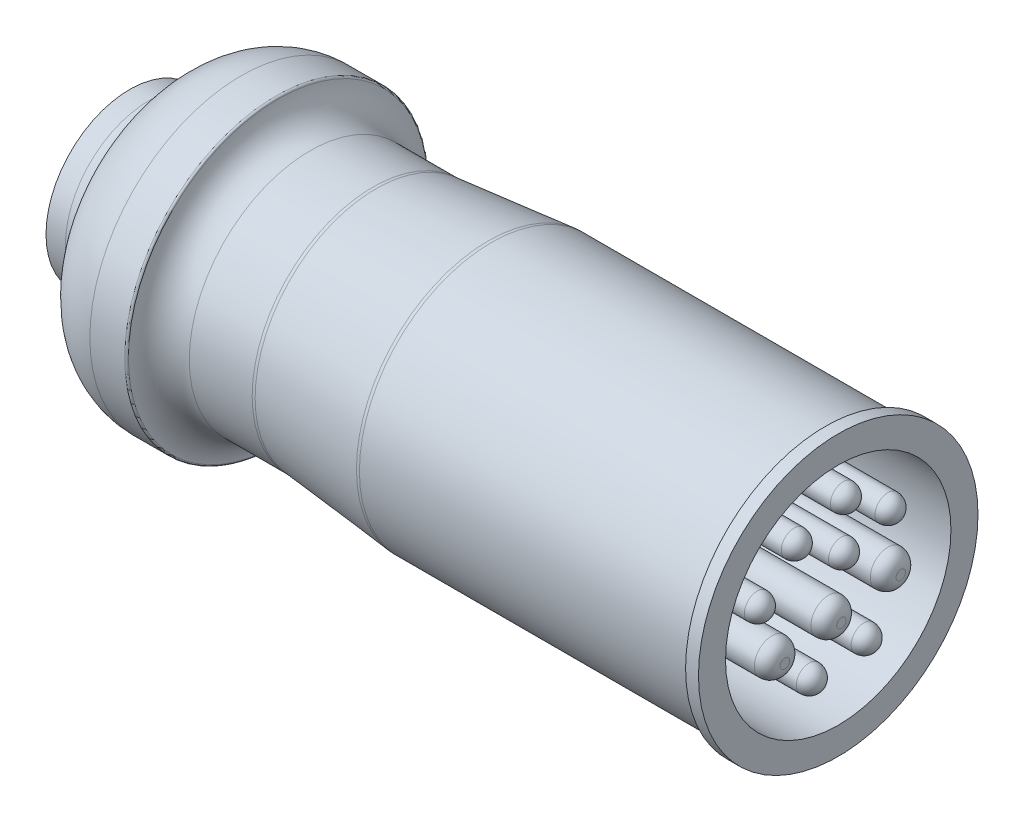
from build123d import *

# Parameters (mm, degrees)
FILLET1_R           = 5
FILLET2_R           = 0.3
FILLET3_R           = 5
SKETCH4_R           = 17.500000000000004
CUT_EXTRUDE1_DEPTH  = 35
SKETCH5_R           = 2.0006066698857174
SKETCH5_R_2         = 2.0006066698857157
SKETCH5_R_3         = 2.000606669885716
SKETCH5_R_4         = 2.733173099565215
BOSS_EXTRUDE1_DEPTH = 35
FILLET4_R           = 2
BOSS_EXTRUDE2_START = -2
SKETCH6_R           = 21.7
SKETCH6_R_2         = 20.5
BOSS_EXTRUDE2_DEPTH = 2


with BuildPart() as part:
    # Sketch3 → Revolve1 (revolve)
    with BuildSketch(Plane.XY, mode=Mode.PRIVATE) as revolve1_sk:
        with BuildLine():
            Line((65, 0), (65, 20.5))
            Line((65, 20.5), (10.914728577346645, 20.499999999999993))
            Line((10.914728577346645, 20.499999999999993), (-6.999999999999965, 18.75))
            Line((-6.999999999999965, 18.75), (-21.999999999999996, 18.749999999999993))
            Line((-21.999999999999996, 18.749999999999993), (-21.999999999999996, 23.5))
            Line((-21.999999999999996, 23.5), (-27.690911978745813, 23.5))
            ThreePointArc((-27.690911978745813, 23.5), (-34.19859974015539, 21.368483523128404), (-38.18424319433221, 15.800000000000004))
            ThreePointArc((-38.18424319433221, 15.800000000000004), (-39.63356808676015, 13.775096900680587), (-41.99999999999999, 13.000000000000009))
            Line((-41.99999999999999, 13.000000000000009), (-45, 13.000000000000004))
            Line((-45, 13.000000000000004), (-45, 0))
            Line((-45, 0), (-41.99999999999999, 0))
            Line((-41.99999999999999, 0), (65, 0))
        make_face()
    revolve(revolve1_sk.sketch.rotate(Axis((0, 0, 0), (1, 0, 0)), 90), axis=Axis((0, 0, 0), (1, 0, 0)))

    # Fillet1
    # the kernel refuses this fillet: 5 mm, written as the material it adds along each edge
    with BuildSketch(Plane(origin=(-21.999999999999996, 0, 0), x_dir=(0, 1.1e-16, 1), z_dir=(0, 1, -1.1e-16))) as fillet1_piece_1:
        with BuildLine():
            CenterArc((23.75, 4.993746088859545), FILLET1_R, 180, 87.13401601740111)
            Line((23.5, 0), (23.495, -0.09987492177718948))
            ThreePointArc((23.495, -0.09987492177718948), (21.124999999999996, -0.10000000000000142), (18.749999999999993, -0.10000000000000142))
            Line((18.749999999999993, -0.10000000000000142), (18.64999999999999, 0))
            Line((18.64999999999999, 0), (18.65, 4.993746088859545))
            Line((18.65, 4.993746088859545), (18.75, 4.993746088859545))
        make_face()
    revolve(axis=Axis((-21.999999999999996, 0, 0), (1, 0, 0)))

    # Fillet2
    fillet2_edges = [part.edges().sort_by_distance(p)[0] for p in [
        (-21.999999999999996, 4.95e-15, -23.5),
    ]]
    fillet(fillet2_edges, radius=FILLET2_R)

    # Fillet3
    # the kernel refuses this fillet: 5 mm, written as the material it adds along each edge
    with BuildSketch(Plane(origin=(-6.999999999999965, 0, 0), x_dir=(0, 1.1e-16, 1), z_dir=(0, 1, -1.1e-16))) as fillet3_piece_1:
        with BuildLine():
            CenterArc((18.75 + FILLET3_R, -FILLET3_R * 0.0487265272305), FILLET3_R, 174.42076403235384, 5.579235967646127)
            Line((18.75 + FILLET3_R * 0.00473730125852, FILLET3_R * 0.0484956949917), (18.75, 0))
            Line((18.75, 0), (18.75, -FILLET3_R * 0.0487265272305))
        make_face()
    revolve(axis=Axis((-6.999999999999965, 0, 0), (1, 0, 0)))
    # the kernel refuses this fillet: 5 mm, written as the material it takes off along each edge
    with BuildSketch(Plane(origin=(10.914728577346645, 0, 0), x_dir=(0, 1.1e-16, 1), z_dir=(0, 1, -1.1e-16))) as fillet3_2_piece_1:
        with BuildLine():
            CenterArc((20.499999999999993 - FILLET3_R, FILLET3_R * 0.0487265272305), FILLET3_R, 354.4207640323539, 5.579235967646187)
            Line((20.499999999999993, FILLET3_R * 0.0487265272305), (20.499999999999993, 0))
            Line((20.499999999999993, 0), (20.499999999999993 - FILLET3_R * 0.00473730125852, -FILLET3_R * 0.0484956949917))
        make_face()
    revolve(axis=Axis((10.914728577346645, 0, 0), (1, 0, 0)), mode=Mode.SUBTRACT)

    # Sketch4 → Cut-Extrude1 (cut)
    with BuildSketch(Plane(origin=(65, 0, 0), x_dir=(0, 0, -1), z_dir=(1, 0, 0))):
        Circle(SKETCH4_R)
    extrude(amount=-CUT_EXTRUDE1_DEPTH, mode=Mode.SUBTRACT)

    # Sketch5 → Boss-Extrude1 (add)
    with BuildSketch(Plane(origin=(30, 0, 0), x_dir=(0, 0, -1), z_dir=(1, 0, 0))):
        with Locations(Location((2.4851998621818705, 3.5673165613128455, 0), (0, 0, 180))):
            Circle(SKETCH5_R)
        with Locations(Location((2.784475529300205, 10.869395236751556, 0), (0, 0, 180))):
            Circle(SKETCH5_R_2)
        with Locations(Location((-4.843943845783035, 8.444175204210639, 0), (0, 0, 180))):
            Circle(SKETCH5_R)
        with Locations(Location((-10.576282104516107, 2.8441216745252547, 0), (0, 0, 180))):
            Circle(SKETCH5_R_3)
        with Locations(Location((9.707376349462452, 5.930765352304601, 0), (0, 0, 180))):
            Circle(SKETCH5_R_3)
        with Locations(Location((-2.5069136326072483, -10.869395236751556, 0), (0, 0, 180))):
            Circle(SKETCH5_R)
        with Locations(Location((6.003403936127238, -9.722927585004939, 0), (0, 0, 180))):
            Circle(SKETCH5_R)
        with Locations(Location((9.707376349462452, -2.1386031196042588, 0), (0, 0, 180))):
            Circle(SKETCH5_R_4)
        with Locations(Location((0.49154022580697854, -3.990589326271869, 0), (0, 0, 180))):
            Circle(SKETCH5_R_4)
        with Locations(Location((-8.28334680102288, -5.048867158653359, 0), (0, 0, 180))):
            Circle(SKETCH5_R_4)
    extrude(amount=BOSS_EXTRUDE1_DEPTH)

    # Fillet4
    fillet4_edges = [part.edges().sort_by_distance(p)[0] for p in [
        (65, 3.567316561312845, -4.485806532067588),
        (65, 10.869395236751556, -4.78508219918592),
        (65, 8.444175204210639, 2.8433371758973176),
        (65, 2.844121674525254, 8.57567543463039),
        (65, 5.9307653523046, -11.707983019348168),
        (65, -10.869395236751556, 0.5063069627215309),
        (65, -9.722927585004939, -8.004010606012956),
        (65, -2.1386031196042583, -12.440549449027667),
        (65, -3.9905893262718686, -3.2247133253721936),
        (65, -5.0488671586533584, 5.550173701457664),
    ]]
    fillet(fillet4_edges, radius=FILLET4_R)

    # Sketch6 → Boss-Extrude2 (add)
    with BuildSketch(Plane(origin=(65, 0, 0), x_dir=(0, 0, -1), z_dir=(1, 0, 0)).offset(BOSS_EXTRUDE2_START)):
        Circle(SKETCH6_R)
        Circle(SKETCH6_R_2, mode=Mode.SUBTRACT)
    extrude(amount=BOSS_EXTRUDE2_DEPTH)


solid = part.part
